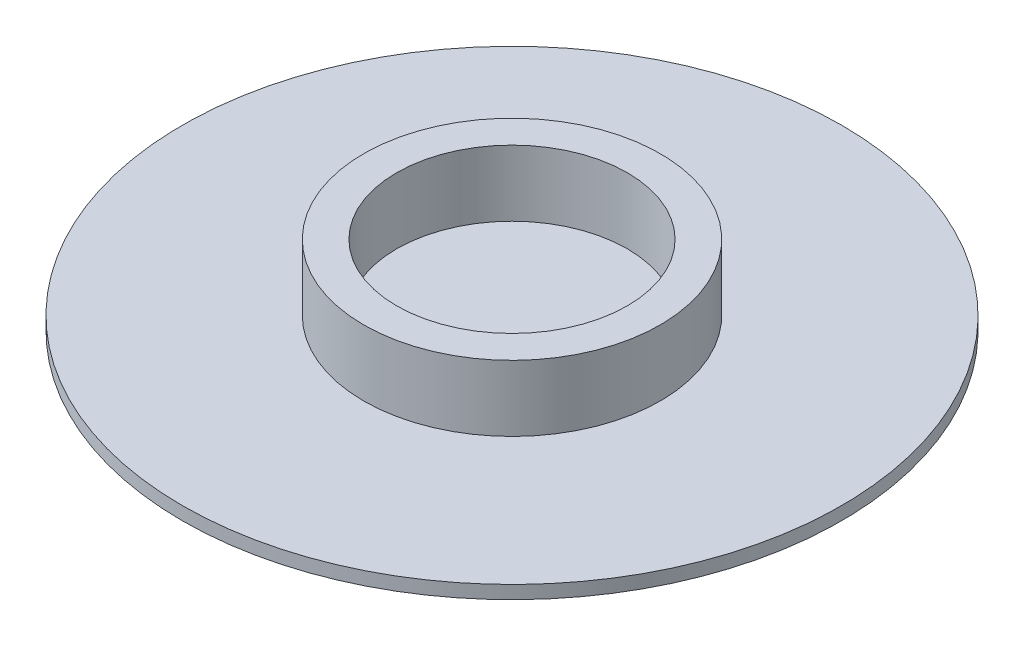
from build123d import *

# Parameters (mm, degrees)
SKETCH1_R           = 63.5
BOSS_EXTRUDE1_DEPTH = 2.54
SKETCH2_R           = 28.575
SKETCH2_R_2         = 22.225
BOSS_EXTRUDE2_DEPTH = 12.7


with BuildPart() as part:
    # Sketch1 → Boss-Extrude1 (new body)
    with BuildSketch(Plane(origin=(0, 0, 0), x_dir=(1, 0, 0), z_dir=(0, 1, 0))):
        Circle(SKETCH1_R)
    extrude(amount=BOSS_EXTRUDE1_DEPTH)

    # Sketch2 → Boss-Extrude2 (add)
    with BuildSketch(Plane(origin=(0, 2.54, 0), x_dir=(1, 0, 0), z_dir=(0, 1, 0))):
        Circle(SKETCH2_R)
        Circle(SKETCH2_R_2, mode=Mode.SUBTRACT)
    extrude(amount=BOSS_EXTRUDE2_DEPTH)


solid = part.part
